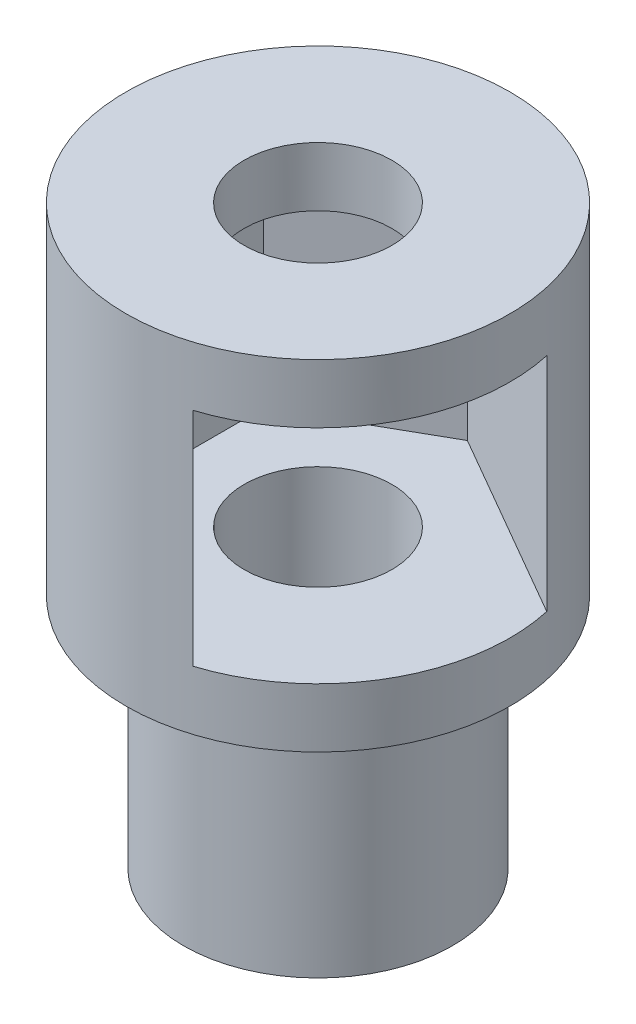
from build123d import *

# Parameters (mm, degrees)
SKETCH1_R           = 4.55
BOSS_EXTRUDE1_DEPTH = 8
SKETCH2_R           = 2.5
CUT_EXTRUDE1_DEPTH  = 8
SKETCH3_R           = 6.5
BOSS_EXTRUDE4_DEPTH = 9.5
CUT_EXTRUDE2_DEPTH  = 7.5
SKETCH6_R           = 6.5
BOSS_EXTRUDE5_DEPTH = 2
SKETCH7_R           = 2.5
CUT_EXTRUDE3_DEPTH  = 22.558061137


with BuildPart() as part:
    # Sketch1 → Boss-Extrude1 (new body)
    with BuildSketch(Plane(origin=(0, 0, 0), x_dir=(1, 0, 0), z_dir=(0, 1, 0))):
        Circle(SKETCH1_R)
    extrude(amount=BOSS_EXTRUDE1_DEPTH)

    # Sketch2 → Cut-Extrude1 (cut)
    with BuildSketch(Plane(origin=(0, 8, 0), x_dir=(1, 0, 0), z_dir=(0, 1, 0))):
        Circle(SKETCH2_R)
    extrude(amount=-CUT_EXTRUDE1_DEPTH, mode=Mode.SUBTRACT)

    # Sketch3 → Boss-Extrude4 (add)
    with BuildSketch(Plane(origin=(0, 8, 0), x_dir=(1, 0, 0), z_dir=(0, 1, 0))):
        Circle(SKETCH3_R)
    extrude(amount=BOSS_EXTRUDE4_DEPTH)

    # Sketch5 → Cut-Extrude2 (cut)
    with BuildSketch(Plane(origin=(0, 17.5, 0), x_dir=(1, 0, 0), z_dir=(0, 1, 0))):
        Polygon((-4.406153459, -2.521016119), (-4.406153459, 2.55966625), (-0.006153459, 5.061357304), (7.819258761, 0.543353452), (3.435994759, -7.048682503), align=None)
    extrude(amount=-CUT_EXTRUDE2_DEPTH, mode=Mode.SUBTRACT)

    # Sketch6 → Boss-Extrude5 (add)
    with BuildSketch(Plane(origin=(0, 17.5, 0), x_dir=(1, 0, 0), z_dir=(0, 1, 0))):
        Circle(SKETCH6_R)
    extrude(amount=BOSS_EXTRUDE5_DEPTH)

    # Sketch7 → Cut-Extrude3 (cut, through all)
    with BuildSketch(Plane.XZ):
        Circle(SKETCH7_R)
    extrude(amount=-CUT_EXTRUDE3_DEPTH, mode=Mode.SUBTRACT)


solid = part.part
